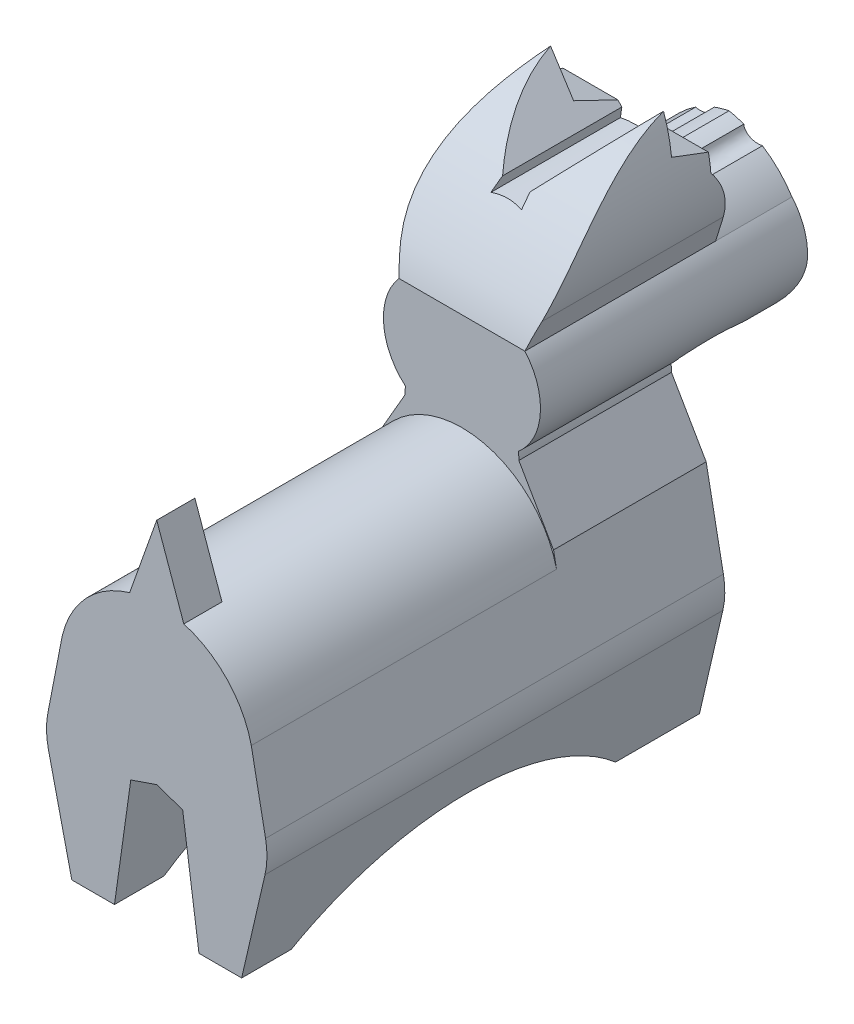
from build123d import *

# Parameters (mm, degrees)
BOSS_EXTRUDE1_DEPTH     = 60
CUT_EXTRUDE1_START      = -40
CUT_EXTRUDE1_DEPTH      = 40
BOSS_EXTRUDE2_START     = -15
BOSS_EXTRUDE2_DEPTH     = 15
CUT_EXTRUDE5_DEPTH      = 93.476100457
CUT_EXTRUDE5_DEPTH_BACK = 93.476100457
CUT_EXTRUDE6_DEPTH      = 10
FILLET2_R               = 10
FILLET3_R               = 10
CUT_EXTRUDE8_DEPTH      = 93.476100522
CUT_EXTRUDE8_DEPTH_BACK = 93.476100522
BOSS_EXTRUDE3_START     = -5
BOSS_EXTRUDE3_DEPTH     = 5
FILLET4_R               = 10
FILLET5_R               = 10
SKETCH11_RX             = 2
SKETCH11_RY             = 1.5
CUT_EXTRUDE9_DEPTH      = 12
CUT_EXTRUDE10_DEPTH     = 12
CUT_EXTRUDE12_DEPTH     = 103.764608926
CUT_EXTRUDE17_DEPTH     = 1
SCALE1_SCALE            = 0.5


with BuildPart() as part:
    # Sketch1 → Boss-Extrude1 (new body)
    with BuildSketch(Plane.XY):
        with BuildLine():
            Line((13.85, 42.7), (12.843956944, 45.95))
            Line((12.843956944, 45.95), (11.172709159, 47.941715552))
            ThreePointArc((11.172709159, 47.941715552), (12.133318076, 54.205762112), (14.7, 60))
            Line((14.7, 60), (20.289275445, 54))
            Line((20.289275445, 54), (20.1, 52.7))
            ThreePointArc((20.1, 52.7), (22.1, 52.915229997), (24.1, 52.7))
            Line((24.1, 52.7), (23.910724555, 54))
            Line((23.910724555, 54), (29.5, 60))
            ThreePointArc((29.5, 60), (32.066681924, 54.205762112), (33.027290841, 47.941715552))
            Line((33.027290841, 47.941715552), (31.356043056, 45.95))
            Line((31.356043056, 45.95), (30.35, 42.7))
            ThreePointArc((30.35, 42.7), (32.371996393, 36.622888016), (29.5, 30.898257355))
            ThreePointArc((29.5, 30.898257355), (27.662369353, 25.175565704), (22.1, 22.898257355))
            ThreePointArc((22.1, 22.898257355), (16.537630647, 25.175565704), (14.7, 30.898257355))
            ThreePointArc((14.7, 30.898257355), (11.828003607, 36.622888016), (13.85, 42.7))
        make_face()
        with BuildLine():
            ThreePointArc((22.1, 22.898257355), (16.890601746, 24.819939165), (14.645300984, 29.898257355))
            Line((14.645300984, 29.898257355), (10.095780863, 22.018257355))
            Line((10.095780863, 22.018257355), (7.432770627, 8.318257355))
            Line((7.432770627, 8.318257355), (10.969671315, -7.001742645))
            Line((10.969671315, -7.001742645), (16.56270902, -7.001742645))
            Line((16.56270902, -7.001742645), (18.700504092, 8.209459688))
            Line((18.700504092, 8.209459688), (22.1, 9.38))
            Line((22.1, 9.38), (25.499495908, 8.209459688))
            Line((25.499495908, 8.209459688), (27.63729098, -7.001742645))
            Line((27.63729098, -7.001742645), (33.230328685, -7.001742645))
            Line((33.230328685, -7.001742645), (36.767229373, 8.318257355))
            Line((36.767229373, 8.318257355), (34.104219137, 22.018257355))
            Line((34.104219137, 22.018257355), (29.554699016, 29.898257355))
            ThreePointArc((29.554699016, 29.898257355), (27.309398254, 24.819939165), (22.1, 22.898257355))
        make_face()
    extrude(amount=BOSS_EXTRUDE1_DEPTH)

    # Sketch2 → Cut-Extrude1 (cut)
    with BuildSketch(Plane.XY.offset(60).offset(CUT_EXTRUDE1_START)):
        with BuildLine():
            Line((9.707020244, 20.018257355), (10.095780863, 22.018257355))
            Line((10.095780863, 22.018257355), (14.645300984, 29.898257355))
            ThreePointArc((14.645300984, 29.898257355), (14.655046272, 30.399220288), (14.7, 30.898257355))
            ThreePointArc((14.7, 30.898257355), (11.828003607, 36.622888016), (13.85, 42.7))
            Line((13.85, 42.7), (12.843956944, 45.95))
            Line((12.843956944, 45.95), (11.172709159, 47.941715552))
            ThreePointArc((11.172709159, 47.941715552), (12.133318076, 54.205762112), (14.7, 60))
            Line((14.7, 60), (20.289275445, 54))
            Line((20.289275445, 54), (20.1, 52.7))
            ThreePointArc((20.1, 52.7), (22.1, 52.915229997), (24.1, 52.7))
            Line((24.1, 52.7), (23.910724555, 54))
            Line((23.910724555, 54), (29.5, 60))
            ThreePointArc((29.5, 60), (32.066681924, 54.205762112), (33.027290841, 47.941715552))
            Line((33.027290841, 47.941715552), (31.356043056, 45.95))
            Line((31.356043056, 45.95), (30.35, 42.7))
            ThreePointArc((30.35, 42.7), (32.371996393, 36.622888016), (29.5, 30.898257355))
            ThreePointArc((29.5, 30.898257355), (29.544953728, 30.399220288), (29.554699016, 29.898257355))
            Line((29.554699016, 29.898257355), (34.104219137, 22.018257355))
            Line((34.104219137, 22.018257355), (34.492979756, 20.018257355))
            ThreePointArc((34.492979756, 20.018257355), (22.1, 29.898257355), (9.707020244, 20.018257355))
        make_face()
    extrude(amount=CUT_EXTRUDE1_DEPTH, mode=Mode.SUBTRACT)

    # Sketch1<4> → Boss-Extrude2 (add)
    with BuildSketch(Plane.XY.offset(BOSS_EXTRUDE2_START)):
        with BuildLine():
            Line((13.85, 42.7), (12.843956944, 45.95))
            Line((12.843956944, 45.95), (11.172709159, 47.941715552))
            ThreePointArc((11.172709159, 47.941715552), (12.133318076, 54.205762112), (14.7, 60))
            Line((14.7, 60), (20.289275445, 54))
            Line((20.289275445, 54), (20.1, 52.7))
            ThreePointArc((20.1, 52.7), (22.1, 52.915229997), (24.1, 52.7))
            Line((24.1, 52.7), (23.910724555, 54))
            Line((23.910724555, 54), (29.5, 60))
            ThreePointArc((29.5, 60), (32.066681924, 54.205762112), (33.027290841, 47.941715552))
            Line((33.027290841, 47.941715552), (31.356043056, 45.95))
            Line((31.356043056, 45.95), (30.35, 42.7))
            ThreePointArc((30.35, 42.7), (32.371996393, 36.622888016), (29.5, 30.898257355))
            ThreePointArc((29.5, 30.898257355), (27.662369353, 25.175565704), (22.1, 22.898257355))
            ThreePointArc((22.1, 22.898257355), (16.537630647, 25.175565704), (14.7, 30.898257355))
            ThreePointArc((14.7, 30.898257355), (11.828003607, 36.622888016), (13.85, 42.7))
        make_face()
    extrude(amount=BOSS_EXTRUDE2_DEPTH)

    # Sketch4 → Cut-Extrude5 (cut, two sides: drawn at the far end of the back side and taken through both)
    with BuildSketch(Plane(origin=(0, 0, 0), x_dir=(0, 0, -1), z_dir=(1, 0, 0)).offset(-CUT_EXTRUDE5_DEPTH_BACK)):
        Polygon((15, 60), (-0.984692077, 60), (-1.69, 56), (2.76, 54.554107352), (2.76, 52.334107352), (15, 48.35709027), align=None)
        with BuildLine():
            Line((15, 22.018257355), (15, 33.778257355))
            Line((15, 33.778257355), (12.1, 29.398257355))
            ThreePointArc((12.1, 29.398257355), (6.409641492, 32.359984043), (0, 32.098257355))
            Line((0, 32.098257355), (0, 22.018257355))
            Line((0, 22.018257355), (15, 22.018257355))
        make_face()
    extrude(amount=CUT_EXTRUDE5_DEPTH + CUT_EXTRUDE5_DEPTH_BACK, mode=Mode.SUBTRACT)

    # Sketch8 → Cut-Extrude6 (cut)
    with BuildSketch(Plane(origin=(0, 0, -15), x_dir=(-1, 0, 0), z_dir=(0, 0, -1))):
        with BuildLine():
            Line((-30.35, 42.7), (-36.35, 42.7))
            Line((-36.35, 42.7), (-36.35, 52.915229997))
            Line((-36.35, 52.915229997), (-7.85, 52.915229997))
            Line((-7.85, 52.915229997), (-7.85, 42.7))
            Line((-7.85, 42.7), (-13.85, 42.7))
            ThreePointArc((-13.85, 42.7), (-17.399492169, 46.36783519), (-22.1, 48.35709027))
            ThreePointArc((-22.1, 48.35709027), (-26.800507831, 46.36783519), (-30.35, 42.7))
        make_face()
    extrude(amount=-CUT_EXTRUDE6_DEPTH, mode=Mode.SUBTRACT)

    # Fillet2
    fillet2_edges = [part.edges().sort_by_distance(p)[0] for p in [
        (22.1, 33.778257355, -15),
    ]]
    fillet(fillet2_edges, radius=FILLET2_R)

    # Fillet3
    # the kernel refuses this fillet: 10 mm, written as the material it takes off along each edge
    with BuildSketch(Plane(origin=(-2.421212194, 51.606287232, -5), x_dir=(0, -1, 0), z_dir=(1, 0, 0))) as fillet3_piece_1_section:
        with BuildLine():
            CenterArc((5.579508951, -10), FILLET3_R, 90, 39.104215809)
            Line((-0.72782012, -2.24), (0, 0))
            Line((0, 0), (5.579508951, 0))
        make_face()
    fillet3_piece_1 = extrude(amount=49.042424388, mode=Mode.PRIVATE)
    fillet3_piece_1 = fillet3_piece_1 - Plane(origin=(19.561790649, 35.811274502, -5), x_dir=(0.19829760557685006, 0.9801418568873018, 0), z_dir=(0, 0, -1)) * Cylinder(12.8, 121, mode=Mode.PRIVATE)
    add(fillet3_piece_1, mode=Mode.SUBTRACT)
    with BuildSketch(Plane(origin=(-2.421212194, 51.606287232, -5), x_dir=(0, -1, 0), z_dir=(1, 0, 0))) as fillet3_piece_2_section:
        with BuildLine():
            CenterArc((5.579508951, -10), FILLET3_R, 90, 39.104215809)
            Line((-0.72782012, -2.24), (0, 0))
            Line((0, 0), (5.579508951, 0))
        make_face()
    fillet3_piece_2 = extrude(amount=49.042424388, mode=Mode.PRIVATE)
    fillet3_piece_2 = fillet3_piece_2 - Plane(origin=(24.638209351, 35.811274502, -5), x_dir=(-0.8428288555768493, 0.5381816795534932, 0), z_dir=(0, 0, -1)) * Cylinder(12.8, 121, mode=Mode.PRIVATE)
    add(fillet3_piece_2, mode=Mode.SUBTRACT)

    # Sketch9 → Cut-Extrude8 (cut, two sides: drawn at the far end of the back side and taken through both)
    with BuildSketch(Plane(origin=(0, 0, 0), x_dir=(0, 0, -1), z_dir=(1, 0, 0)).offset(-CUT_EXTRUDE8_DEPTH_BACK)):
        with BuildLine():
            Line((-20, 42.7), (-20, 60))
            Line((-20, 60), (-0.984692077, 60))
            ThreePointArc((-0.984692077, 60), (-12.886372316, 53.981395771), (-20, 42.7))
        make_face()
        with BuildLine():
            Line((-11, -7.001742645), (-53.5, -7.001742645))
            ThreePointArc((-53.5, -7.001742645), (-32.25, 1.07259122), (-11, -7.001742645))
        make_face()
    extrude(amount=CUT_EXTRUDE8_DEPTH + CUT_EXTRUDE8_DEPTH_BACK, mode=Mode.SUBTRACT)

    # Sketch10 → Boss-Extrude3 (add)
    with BuildSketch(Plane.XY.offset(60).offset(BOSS_EXTRUDE3_START)):
        with BuildLine():
            Line((18.55, 29.392527002), (22.1, 39.392527002))
            Line((22.1, 39.392527002), (25.65, 29.392527002))
            ThreePointArc((25.65, 29.392527002), (22.1, 29.898257355), (18.55, 29.392527002))
        make_face()
    extrude(amount=BOSS_EXTRUDE3_DEPTH)

    # Fillet4
    fillet4_edges = [part.edges().sort_by_distance(p)[0] for p in [
        (36.767229373, 8.318257355, 30),
    ]]
    fillet(fillet4_edges, radius=FILLET4_R)

    # Fillet5
    fillet5_edges = [part.edges().sort_by_distance(p)[0] for p in [
        (7.432770627, 8.318257355, 30),
    ]]
    fillet(fillet5_edges, radius=FILLET5_R)

    # Sketch11 → Cut-Extrude9 (cut)
    with BuildSketch(Plane(origin=(0, 0, -15), x_dir=(-1, 0, 0), z_dir=(0, 0, -1))):
        with Locations(Location((-18.18429899, 48.022078269), (0, 0, 6.171221478))):
            Ellipse(SKETCH11_RX, SKETCH11_RY)
        with Locations(Location((-26.01570101, 48.022078269), (0, 0, 173.828778522))):
            Ellipse(SKETCH11_RX, SKETCH11_RY)
    extrude(amount=-CUT_EXTRUDE9_DEPTH, mode=Mode.SUBTRACT)

    # Sketch13 → Cut-Extrude10 (cut)
    with BuildSketch(Plane(origin=(0, 0, -15), x_dir=(-1, 0, 0), z_dir=(0, 0, -1))):
        with BuildLine():
            ThreePointArc((-22.100000155, 29.398257355), (-25.875248412, 29.777032245), (-29.5, 30.898257355))
            Line((-29.5, 30.898257355), (-30.5, 30.898257355))
            Line((-30.5, 30.898257355), (-30.5, 29.398257355))
            Line((-30.5, 29.398257355), (-29.529222805, 29.398257355))
            Line((-29.529222805, 29.398257355), (-22.100000155, 29.398257355))
        make_face()
        with BuildLine():
            ThreePointArc((-14.7, 30.898257355), (-18.32475174, 29.777032214), (-22.100000155, 29.398257355))
            Line((-22.100000155, 29.398257355), (-14.670777195, 29.398257355))
            Line((-14.670777195, 29.398257355), (-13.7, 29.398257355))
            Line((-13.7, 29.398257355), (-13.7, 30.898257355))
            Line((-13.7, 30.898257355), (-14.7, 30.898257355))
        make_face()
    extrude(amount=-CUT_EXTRUDE10_DEPTH, mode=Mode.SUBTRACT)

    # Sketch14 → Cut-Extrude12 (cut, through all)
    with BuildSketch(Plane(origin=(0, 0, -15), x_dir=(-1, 0, 0), z_dir=(0, 0, -1))):
        with BuildLine():
            Line((-14.7, 60), (-10.7, 60))
            Line((-10.7, 60), (-10.7, 45.95))
            Line((-10.7, 45.95), (-12.843956944, 45.95))
            ThreePointArc((-12.843956944, 45.95), (-12.331042062, 53.165351603), (-14.7, 60))
        make_face()
        with BuildLine():
            Line((-29.5, 60), (-33.5, 60))
            Line((-33.5, 60), (-33.5, 45.95))
            Line((-33.5, 45.95), (-31.356043056, 45.95))
            ThreePointArc((-31.356043056, 45.95), (-31.868957938, 53.165351603), (-29.5, 60))
        make_face()
    extrude(amount=-CUT_EXTRUDE12_DEPTH, mode=Mode.SUBTRACT)

    # Sketch16 → Cut-Extrude17 (cut)
    with BuildSketch(Plane(origin=(0, 3.390004651, 5.120075991), x_dir=(-1, 0, 0), z_dir=(0, -0.5520615751174244, -0.8338033444876967))):
        with BuildLine():
            ThreePointArc((-29.635533027, 33.134874419), (-25.627874664, 32.80505382), (-22.1, 34.734874419))
            ThreePointArc((-22.1, 34.734874419), (-18.572125336, 32.80505382), (-14.564466973, 33.134874419))
            ThreePointArc((-14.564466973, 33.134874419), (-18.669647701, 33.079148985), (-22.1, 35.334874419))
            ThreePointArc((-22.1, 35.334874419), (-25.530352299, 33.079148985), (-29.635533027, 33.134874419))
        make_face()
    extrude(amount=-CUT_EXTRUDE17_DEPTH, mode=Mode.SUBTRACT)


with BuildPart() as part_1:
    # Scale1: scaled about (22.099999997, 20.310649467, 23.514524472)
    add(part.part.scale(SCALE1_SCALE).moved(Location((11.049999999, 10.155324734, 11.757262236))))


solid = part_1.part
